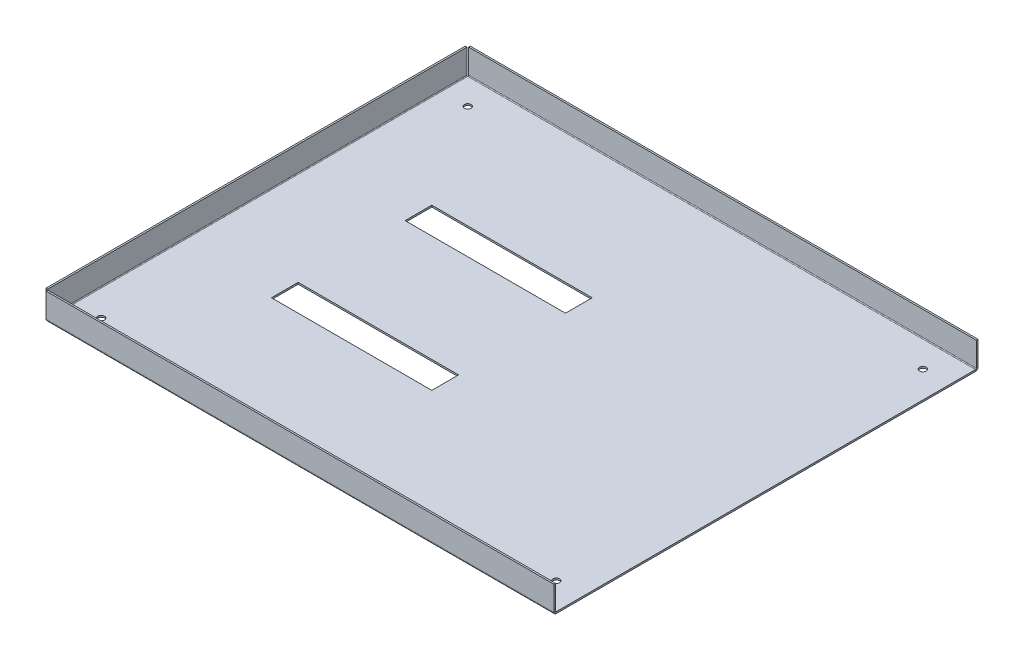
from build123d import *

# Parameters (mm, degrees)
SKETCH3_W          = 482.5780122
SKETCH3_H          = 398.4879
BASE_FLANGE1_DEPTH = 1.5875
EDGE_FLANGE1_DEPTH = 482.5780122
EDGE_FLANGE2_DEPTH = 482.5780122
EDGE_FLANGE4_DEPTH = 398.4879
SKETCH20_W         = 152.4
SKETCH20_H         = 25.4
CUT_EXTRUDE1_DEPTH = 1.5875
SKETCH21_R         = 3.175
CUT_EXTRUDE2_DEPTH = 1.5875


# Sheet-metal steps are written as plain solids
with BuildPart() as part:
    # Sketch3 → Base-Flange1 (new body)
    with BuildSketch(Plane(origin=(0, 0, 0), x_dir=(1, 0, 0), z_dir=(0, 1, 0))):
        with Locations((241.2890061, 199.24395)):
            Rectangle(SKETCH3_W, SKETCH3_H)
    extrude(amount=-BASE_FLANGE1_DEPTH)

    # Edge-Flange1 section (across the edge) → Edge-Flange1 (add)
    with BuildSketch(Plane(origin=(0, 0, 0.7366), x_dir=(0, 0, -1), z_dir=(1, 0, 0))):
        with BuildLine():
            Line((-1.5875, 0.7366), (-1.5875, 23.8125))
            Line((-1.5875, 23.8125), (0, 23.8125))
            Line((0, 23.8125), (0, 0.7366))
            ThreePointArc((0, 0.7366), (0.215745145, 0.215745145), (0.7366, 0))
            Line((0.7366, 0), (0.7366, -1.5875))
            ThreePointArc((0.7366, -1.5875), (-0.90678687, -0.90678687), (-1.5875, 0.7366))
        make_face()
    extrude(amount=EDGE_FLANGE1_DEPTH)

    # Edge-Flange2 section (across the edge) → Edge-Flange2 (add)
    with BuildSketch(Plane(origin=(482.5780122, 0, -399.2245), x_dir=(0, 0, 1), z_dir=(-1, 0, 0))):
        with BuildLine():
            Line((-1.5875, 0.7366), (-1.5875, 23.8125))
            Line((-1.5875, 23.8125), (0, 23.8125))
            Line((0, 23.8125), (0, 0.7366))
            ThreePointArc((0, 0.7366), (0.215745145, 0.215745145), (0.7366, 0))
            Line((0.7366, 0), (0.7366, -1.5875))
            ThreePointArc((0.7366, -1.5875), (-0.90678687, -0.90678687), (-1.5875, 0.7366))
        make_face()
    extrude(amount=EDGE_FLANGE2_DEPTH)

    # Edge-Flange4 section (across the edge) → Edge-Flange4 (add)
    with BuildSketch(Plane(origin=(-0.7366, 0, -398.4879), x_dir=(1, 0, 0), z_dir=(0, 0, 1))):
        with BuildLine():
            Line((-1.5875, 0.7366), (-1.5875, 23.8125))
            Line((-1.5875, 23.8125), (0, 23.8125))
            Line((0, 23.8125), (0, 0.7366))
            ThreePointArc((0, 0.7366), (0.215745145, 0.215745145), (0.7366, 0))
            Line((0.7366, 0), (0.7366, -1.5875))
            ThreePointArc((0.7366, -1.5875), (-0.90678687, -0.90678687), (-1.5875, 0.7366))
        make_face()
    extrude(amount=EDGE_FLANGE4_DEPTH)

    # Sketch20 → Cut-Extrude1 (cut)
    with BuildSketch(Plane(origin=(0, 0, 0), x_dir=(1, 0, 0), z_dir=(0, 1, 0))):
        with Locations((165.0890061, 135.74395)):
            Rectangle(SKETCH20_W, SKETCH20_H)
        with Locations((165.0890061, 262.74395)):
            Rectangle(SKETCH20_W, SKETCH20_H)
    extrude(amount=-CUT_EXTRUDE1_DEPTH, mode=Mode.SUBTRACT)

    # Sketch21 → Cut-Extrude2 (cut)
    with BuildSketch(Plane(origin=(0, 0, 0), x_dir=(1, 0, 0), z_dir=(0, 1, 0))):
        with Locations(Location((24.6634, 373.8245, 0), (0, 0, 270))):
            Circle(SKETCH21_R)
        with Locations(Location((457.1780122, 373.8245, 0), (0, 0, 270))):
            Circle(SKETCH21_R)
        with Locations(Location((457.1780122, 25.4, 0), (0, 0, 270))):
            Circle(SKETCH21_R)
        with Locations(Location((24.6634, 25.4, 0), (0, 0, 270))):
            Circle(SKETCH21_R)
    extrude(amount=-CUT_EXTRUDE2_DEPTH, mode=Mode.SUBTRACT)


solid = part.part
